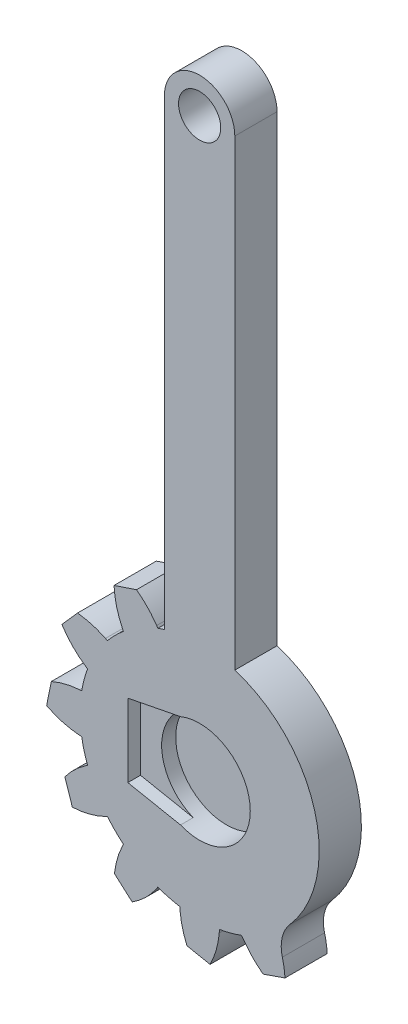
from build123d import *

# Parameters (mm, degrees)
SKETCH1_R           = 1.5
BOSS_EXTRUDE1_DEPTH = 3
CUT_EXTRUDE2_DEPTH  = 0.9
SKETCH5_W           = 3.6
SKETCH5_H           = 3
FILLET1_R           = 2.5


with BuildPart() as part:
    # Sketch1 → Boss-Extrude1 (new body)
    with BuildSketch(Plane.XY.offset(1.9)):
        with BuildLine():
            Line((2.5, 8.124038405), (2.5, 41))
            ThreePointArc((2.5, 41), (0, 43.5), (-2.5, 41))
            Line((-2.5, 41), (-2.5, 8.124038405))
            ThreePointArc((-2.5, 8.124038405), (-2.735010245, 8.047963653), (-2.967710696, 7.965092167))
            Line((-2.967710696, 7.965092167), (-3.054167872, 8.093270203))
            ThreePointArc((-3.054167872, 8.093270203), (-4.342095244, 9.472160372), (-5.994566265, 10.382893341))
            ThreePointArc((-5.994566265, 10.382893341), (-6.032083889, 8.496444973), (-5.481893659, 6.691622066))
            Line((-5.481893659, 6.691622066), (-5.414116812, 6.552658937))
            ThreePointArc((-5.414116812, 6.552658937), (-6.01040764, 6.01040764), (-6.552658937, 5.414116812))
            Line((-6.552658937, 5.414116812), (-6.691622066, 5.481893659))
            ThreePointArc((-6.691622066, 5.481893659), (-8.496444973, 6.032083889), (-10.382893341, 5.994566265))
            ThreePointArc((-10.382893341, 5.994566265), (-9.472160372, 4.342095244), (-8.093270203, 3.054167872))
            Line((-8.093270203, 3.054167872), (-7.965092167, 2.967710696))
            ThreePointArc((-7.965092167, 2.967710696), (-8.210369523, 2.199961883), (-8.381827508, 1.41243323))
            Line((-8.381827508, 1.41243323), (-8.536061531, 1.401648136))
            ThreePointArc((-8.536061531, 1.401648136), (-10.374179133, 0.975715399), (-11.989132531, 0))
            ThreePointArc((-11.989132531, 0), (-10.374179133, -0.975715399), (-8.536061531, -1.401648136))
            Line((-8.536061531, -1.401648136), (-8.381827508, -1.41243323))
            ThreePointArc((-8.381827508, -1.41243323), (-8.210369523, -2.199961883), (-7.965092167, -2.967710696))
            Line((-7.965092167, -2.967710696), (-8.093270203, -3.054167872))
            ThreePointArc((-8.093270203, -3.054167872), (-9.472160372, -4.342095244), (-10.382893341, -5.994566265))
            ThreePointArc((-10.382893341, -5.994566265), (-8.496444973, -6.032083889), (-6.691622066, -5.481893659))
            Line((-6.691622066, -5.481893659), (-6.552658937, -5.414116812))
            ThreePointArc((-6.552658937, -5.414116812), (-6.01040764, -6.01040764), (-5.414116812, -6.552658937))
            Line((-5.414116812, -6.552658937), (-5.481893659, -6.691622066))
            ThreePointArc((-5.481893659, -6.691622066), (-6.032083889, -8.496444973), (-5.994566265, -10.382893341))
            ThreePointArc((-5.994566265, -10.382893341), (-4.342095244, -9.472160372), (-3.054167872, -8.093270203))
            Line((-3.054167872, -8.093270203), (-2.967710696, -7.965092167))
            ThreePointArc((-2.967710696, -7.965092167), (-2.200030635, -8.210351101), (-1.412573605, -8.381803852))
            Line((-1.412573605, -8.381803852), (-1.393124693, -8.60968341))
            ThreePointArc((-1.393124693, -8.60968341), (-0.957124189, -10.404769076), (-0.000200717, -11.984872381))
            ThreePointArc((-0.000200717, -11.984872381), (0.95677568, -10.404801129), (1.39283631, -8.609730068))
            Line((1.39283631, -8.609730068), (1.412292855, -8.381851161))
            ThreePointArc((1.412292855, -8.381851161), (2.199774454, -8.210495053), (2.967443903, -7.965191566))
            Line((2.967443903, -7.965191566), (3.392820223, -8.498315042))
            ThreePointArc((3.392820223, -8.498315042), (4.564279824, -9.615969997), (5.992088536, -10.379404655))
            ThreePointArc((5.992088536, -10.379404655), (6.04494749, -8.761172247), (5.662865105, -7.187805396))
            Line((5.662865105, -7.187805396), (5.413897328, -6.552840279))
            ThreePointArc((5.413897328, -6.552840279), (7.689867596, -3.621593069), (8.5, 0))
            ThreePointArc((8.5, 0), (6.837397166, 5.049752469), (2.5, 8.124038405))
        make_face()
        with Locations((0, 41)):
            Circle(SKETCH1_R, mode=Mode.SUBTRACT)
    extrude(amount=-BOSS_EXTRUDE1_DEPTH)

    # Sketch4 → Cut-Extrude2 (cut)
    with BuildSketch(Plane.XY.offset(1.9)):
        with BuildLine():
            Line((-5.102940329, -2.6), (-1.358771093, -3.333727811))
            ThreePointArc((-1.358771093, -3.333727811), (-3.6, 0), (-1.358771093, 3.333727811))
            Line((-1.358771093, 3.333727811), (-5.102940329, 2.6))
            Line((-5.102940329, 2.6), (-5.102940329, -2.6))
        make_face()
    extrude(amount=-CUT_EXTRUDE2_DEPTH, mode=Mode.SUBTRACT)

    # Sketch5 → Cut-Revolve1 (revolve, cut)
    with BuildSketch(Plane(origin=(0, 0, 0), x_dir=(1, 0, 0), z_dir=(0, 1, 0))):
        with Locations((1.8, -1.5)):
            Rectangle(SKETCH5_W, SKETCH5_H)
    revolve(axis=Axis((0, 0, 0), (0, 0, 1)), mode=Mode.SUBTRACT)

    # Chamfer1
    # the kernel refuses this chamfer: 1.996823512, 1.978396736, 1.94931332, 1.412365401 mm, written as the material it takes off along each edge
    with BuildSketch(Plane(origin=(5.992088536, -10.379404655, 6.233820359), x_dir=(-0.8794300447910056, 0.4760281465616188, 0), z_dir=(0, 0, -1))) as chamfer1_piece_1:
        with BuildLine():
            Line((1.679904515, 0), (0.570181749, 1.211368913))
            ThreePointArc((0.570181749, 1.211368913), (0.257488937, 0.635031779), (0, 0))
            ThreePointArc((0, 0), (0.866421107, -0.059071898), (1.679904515, 0))
        make_face()
    extrude(amount=11.667640718, mode=Mode.SUBTRACT)
    with BuildSketch(Plane(origin=(-0.000200717, -11.984872381, 6.284042251), x_dir=(0.553758056262258, 0.8326776177637093, 0), z_dir=(0, 0, -1))) as chamfer1_piece_2:
        with BuildLine():
            Line((1.33943628, 0), (0.703391742, -1.546031937))
            ThreePointArc((0.703391742, -1.546031937), (0.308543545, -0.822544611), (0, 0))
            ThreePointArc((0, 0), (0.684773692, 0.037130534), (1.33943628, 0))
        make_face()
    extrude(amount=11.768084503, mode=Mode.SUBTRACT)
    with BuildSketch(Plane(origin=(-5.994566265, -10.382893341, 6.307600342), x_dir=(0.8971018613244867, 0.44182377754953556, 0), z_dir=(0, 0, -1)), Plane(origin=(-10.382893341, -5.994566265, 6.307600342), x_dir=(0.9978248904640774, -0.06592031530834563, 0), z_dir=(0, 0, -1)), Plane(origin=(-11.989132531, 0, 6.307600342), x_dir=(0.8311815460161414, -0.5560011129145489, 0), z_dir=(0, 0, -1))) as chamfer1_piece_3:
        with BuildLine():
            Line((1.33889649, 0), (0.700148491, -1.556942978))
            ThreePointArc((0.700148491, -1.556942978), (0.305807457, -0.828670891), (0, 0))
            ThreePointArc((0, 0), (0.684607685, 0.037444556), (1.33889649, 0))
        make_face()
    extrude(amount=11.815200684, mode=Mode.SUBTRACT)
    with BuildSketch(Plane(origin=(-10.382893341, 5.994566265, 6.307600342), x_dir=(0.9993864811320993, 0.035023725250178994, 0), z_dir=(0, 0, -1)), Plane(origin=(-5.994566265, 10.382893341, 6.307600342), x_dir=(0.8830059434842266, -0.4693618047642254, 0), z_dir=(0, 0, -1))) as chamfer1_piece_4:
        with BuildLine():
            Line((1.707126049, 0), (0.549125448, 1.221108125))
            ThreePointArc((0.549125448, 1.221108125), (0.246629708, 0.639737105), (0, 0))
            ThreePointArc((0, 0), (0.881190909, -0.060960877), (1.707126049, 0))
        make_face()
    extrude(amount=11.815200684, mode=Mode.SUBTRACT)

    # Fillet1
    fillet1_edges = [part.edges().sort_by_distance(p)[0] for p in [
        (5.413897328, -6.552840279, 0.4),
    ]]
    fillet(fillet1_edges, radius=FILLET1_R)


solid = part.part
